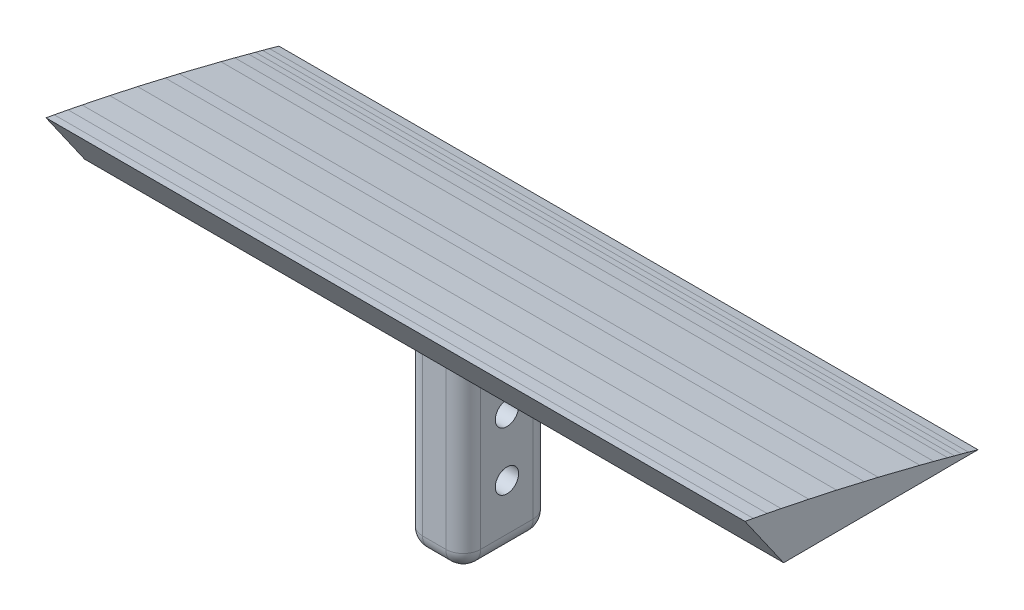
from build123d import *

# Parameters (mm, degrees)
BOSS_EXTRUDE1_DEPTH             = 60
BOSS_EXTRUDE2_REACH             = 90.732
SKETCH5_W                       = 5
SKETCH5_H                       = 7.5
BOSS_EXTRUDE2_DIRECTION_2_DEPTH = 15
FILLET1_R                       = 1.5
CUT_EXTRUDE1_REACH              = 75.969
SKETCH6_R                       = 1


# Read off the part's stored shape, not the designer's step: Boss-Extrude1
with BuildPart() as part:
    # Boss-Extrude1 outline → Boss-Extrude1 (new body)
    with BuildSketch(Plane(origin=(0, 0, 0), x_dir=(0, 0, -1), z_dir=(1, 0, 0))):
        Polygon((45.19977735, 6.923160404), (48.514979298, 2.188561349), (50.553744228, 2.192162497), (51.753724693, 2.204282084), (56.563717189, 2.212778158), (57.763697654, 2.224897745), (61.363692038, 2.231256553), (62.563672503, 2.24337614), (64.963668759, 2.247615346), (65.19977735, 2.25), (64.373245759, 2.486572833), (63.782964065, 2.645530446), (63.182682388, 2.804470395), (62.592400694, 2.963428007), (61.401837323, 3.281325569), (60.211291616, 3.589223146), (56.639707483, 4.482915924), (55.439214781, 4.760795885), (53.058229346, 5.316591132), (50.677314564, 5.832386443), (48.296435109, 6.328181784), (47.09601306, 6.566061807), (45.905608659, 6.793959509), align=None)
    extrude(amount=BOSS_EXTRUDE1_DEPTH)

    # Sketch5 → Boss-Extrude2 (add, up to next)
    with BuildSketch(Plane(origin=(0, 2.188561349, 0), x_dir=(1, 0, 0), z_dir=(0, 1, 0)), mode=Mode.PRIVATE) as boss_extrude2_sk1:
        with Locations((30, 52.264979298)):
            Rectangle(SKETCH5_W, SKETCH5_H)
    boss_extrude2_tool1 = extrude(boss_extrude2_sk1.sketch, amount=BOSS_EXTRUDE2_REACH, mode=Mode.PRIVATE) - part.part
    add(boss_extrude2_tool1.solids().sort_by_distance((30, 2.188561, -52.264979))[0])

    # Sketch5 → Boss-Extrude2 direction 2 (add)
    with BuildSketch(Plane(origin=(0, 2.188561349, 0), x_dir=(1, 0, 0), z_dir=(0, 1, 0))):
        with Locations((30, 52.264979298)):
            Rectangle(SKETCH5_W, SKETCH5_H)
    extrude(amount=-BOSS_EXTRUDE2_DIRECTION_2_DEPTH)

    # Fillet1
    fillet1_edges = [part.edges().sort_by_distance(p)[0] for p in [
        (27.5, -5.311438651, -48.514979298),
        (27.5, -12.811438651, -52.264979298),
        (27.5, -5.299814875, -56.014979298),
        (30, -12.811438651, -56.014979298),
        (32.5, -5.299814875, -56.014979298),
        (32.5, -12.811438651, -52.264979298),
        (30, -12.811438651, -48.514979298),
        (32.5, -5.311438651, -48.514979298),
    ]]
    fillet(fillet1_edges, radius=FILLET1_R)

    # Sketch6 → Cut-Extrude1 (cut, up to next)
    with BuildSketch(Plane.ZY.offset(-27.5), mode=Mode.PRIVATE) as cut_extrude1_sk1:
        with Locations((-52.264979298, -7.311438651)):
            Circle(SKETCH6_R)
    cut_extrude1_tool1 = extrude(cut_extrude1_sk1.sketch, amount=-CUT_EXTRUDE1_REACH, mode=Mode.PRIVATE) & part.part
    # Sketch6 → Cut-Extrude1 (cut, up to next)
    with BuildSketch(Plane.ZY.offset(-27.5), mode=Mode.PRIVATE) as cut_extrude1_sk2:
        with Locations((-52.264979298, -2.311438651)):
            Circle(SKETCH6_R)
    cut_extrude1_tool2 = extrude(cut_extrude1_sk2.sketch, amount=-CUT_EXTRUDE1_REACH, mode=Mode.PRIVATE) & part.part
    add(cut_extrude1_tool1.solids().sort_by_distance((27.5, -7.311439, -52.264979))[0], mode=Mode.SUBTRACT)
    add(cut_extrude1_tool2.solids().sort_by_distance((27.5, -2.311439, -52.264979))[0], mode=Mode.SUBTRACT)


solid = part.part
